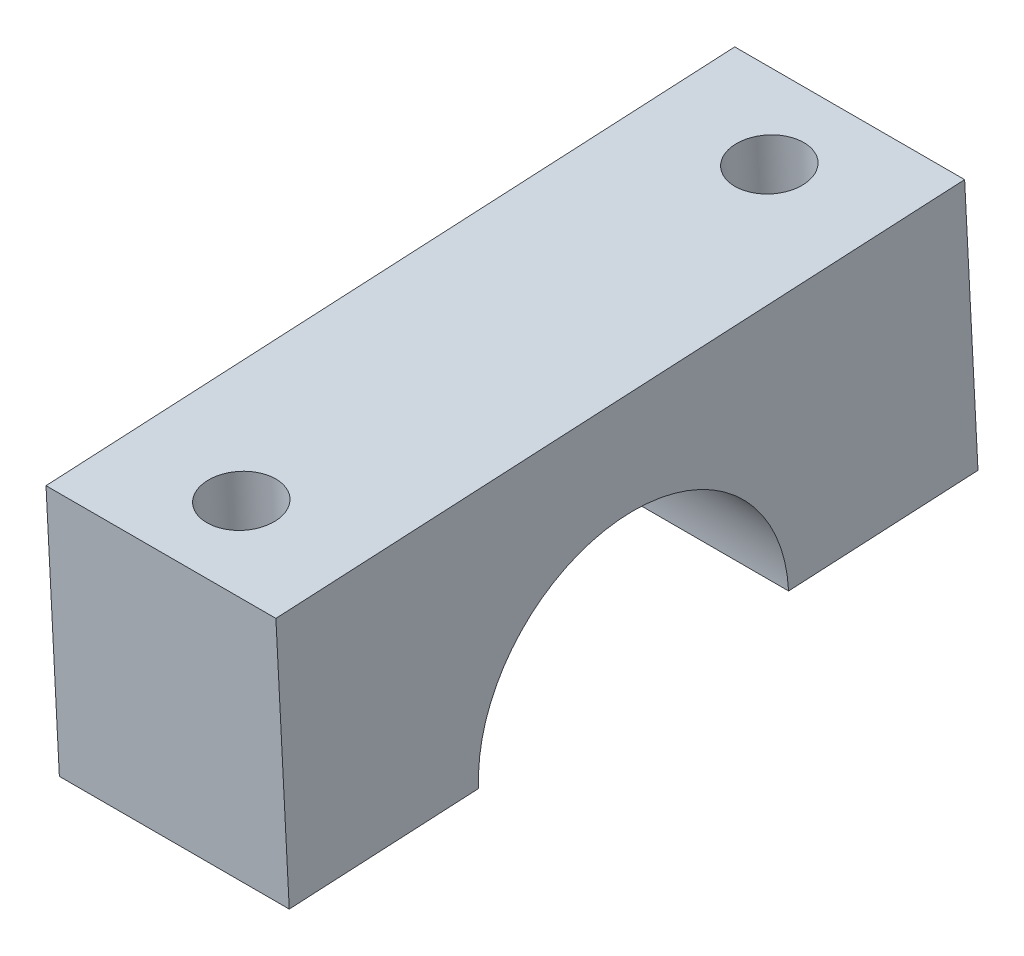
from build123d import *

# Parameters (mm, degrees)
EXTRUDE_1_DEPTH     = 20
SKETCH_3_R          = 13.5
CUT_EXTRUDE_1_DEPTH = 20
SKETCH_4_R          = 3
CUT_EXTRUDE_2_DEPTH = 22.516585743


# Read off the part's stored shape, not the designer's step: 填料-伸長1
with BuildPart() as part:
    # 填料-伸長1 outline → 填料-伸長1 (new body)
    with BuildSketch(Plane(origin=(0, 0, 0), x_dir=(0, 0, -1), z_dir=(1, 0, 0))):
        Polygon((-4019.675958787, 200.25160655), (-4018.512862627, 177.765080788), (-3958.59296353, 180.864385914), (-3959.75605969, 203.350911676), align=None)
    extrude(amount=EXTRUDE_1_DEPTH)

    # 草圖3 → 除料-伸長1 (cut)
    with BuildSketch(Plane.ZY):
        with Locations((3988.552913079, 179.314733351)):
            Circle(SKETCH_3_R)
    extrude(amount=-CUT_EXTRUDE_1_DEPTH, mode=Mode.SUBTRACT)

    # 草圖4 → 除料-伸長2 (cut)
    with BuildSketch(Plane(origin=(0, 407.076792548, 21.055696166), x_dir=(1, 0, 0), z_dir=(0, 0.9986649849421085, 0.051655085428040495))):
        with Locations(Location((10, -3950.965617011, 0), (0, 0, 270))):
            Circle(SKETCH_4_R)
    cut_extrude_2 = extrude(amount=-CUT_EXTRUDE_2_DEPTH, mode=Mode.SUBTRACT)

    # 鏡射1: 除料-伸長2 across plane
    add(cut_extrude_2.mirror(Plane(origin=(0, -205.275533435, 3968.660313072), x_dir=(1, 0, 0), z_dir=(0, 0.05165508542804326, -0.9986649849421085))), mode=Mode.SUBTRACT)


solid = part.part
